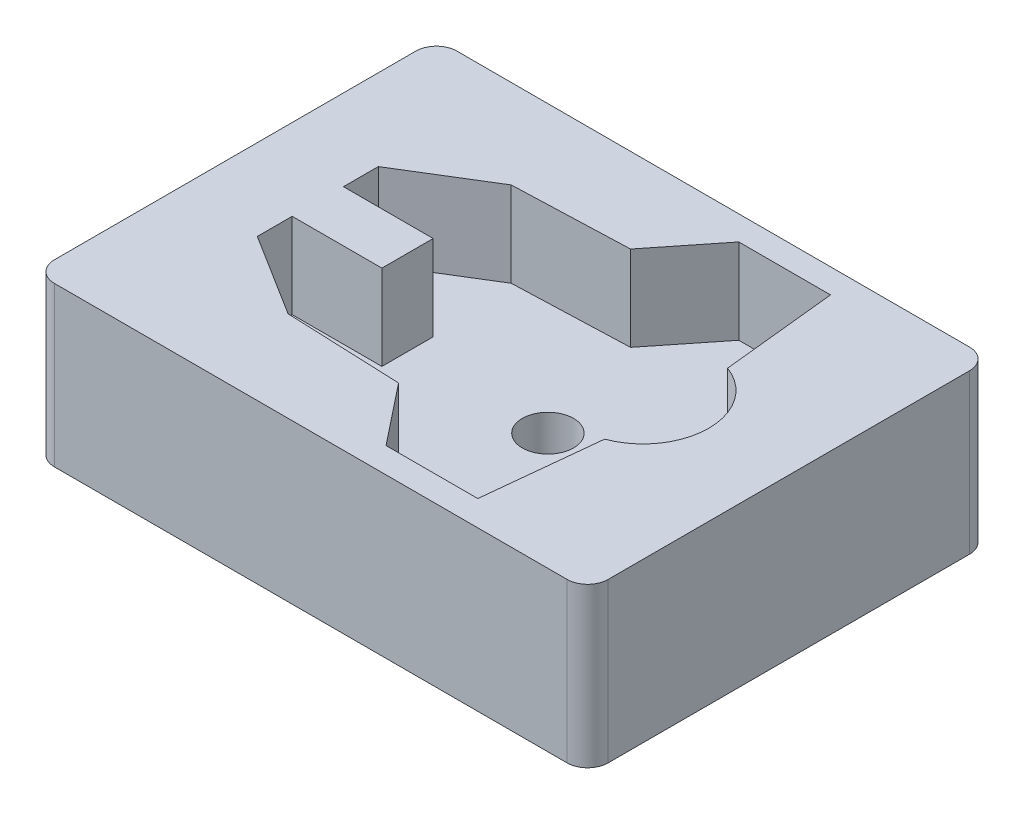
from build123d import *

# Parameters (mm, degrees)
SKETCH1_W              = 54
SKETCH1_H              = 39.25
BOSS_EXTRUDE1_DEPTH    = 15.5
FILLET1_R              = 2
FILLET2_R              = 2
M3_A_START             = -3.329776532
M3_A_BLANK_DEPTH       = 9
M3_A_START_2           = -9.329776532
M3_A_BLANK_2_OUTLINE_R = 2.5
M3_A_BLANK_2_DEPTH     = 6
BODY_MOVE_COPY6_ANGLE  = 90
CUT_EXTRUDE1_DEPTH     = 13.5


with BuildPart() as part:
    # Sketch1 → Boss-Extrude1 (new body)
    with BuildSketch(Plane(origin=(0, 0, 0), x_dir=(1, 0, 0), z_dir=(0, 1, 0))):
        with Locations((27, 19.625)):
            Rectangle(SKETCH1_W, SKETCH1_H)
    extrude(amount=BOSS_EXTRUDE1_DEPTH)

    # Fillet1
    fillet1_edges = [part.edges().sort_by_distance(p)[0] for p in [
        (0, 7.75, 0),
    ]]
    fillet(fillet1_edges, radius=FILLET1_R)

    # Fillet2
    fillet2_edges = [part.edges().sort_by_distance(p)[0] for p in [
        (0, 7.75, -39.25),
        (54, 7.75, -39.25),
        (54, 7.75, 0),
    ]]
    fillet(fillet2_edges, radius=FILLET2_R)


with BuildPart() as body_2:
    # M3-A Blank: read off the stored shape, not the designer's step
    # M3-A Blank outline → M3-A Blank (new body)
    with BuildSketch(Plane(origin=(0, 0, 0), x_dir=(1, 0, 0), z_dir=(0, 1, 0)).offset(M3_A_START)):
        with BuildLine():
            Line((-41.581939277, 43.861919588), (-30.381939277, 42.692718591))
            ThreePointArc((-30.381939277, 42.692718591), (-24.381939277, 38.532817401), (-18.381939277, 42.692718591))
            Line((-18.381939277, 42.692718591), (-7.181939277, 43.861919588))
            Line((-7.181939277, 43.861919588), (-7.181939277, 52.808848959))
            Line((-7.181939277, 52.808848959), (-13.057281533, 57.485652948))
            Line((-13.057281533, 57.485652948), (-13.463960141, 68.720149487))
            Line((-13.463960141, 68.720149487), (-18.39493826, 76.75205199))
            Line((-18.39493826, 76.75205199), (-21.79493826, 76.75205199))
            Line((-21.79493826, 76.75205199), (-21.79493826, 68.00205199))
            Line((-21.79493826, 68.00205199), (-26.79493826, 68.00205199))
            Line((-26.79493826, 68.00205199), (-26.79493826, 76.75205199))
            Line((-26.79493826, 76.75205199), (-30.19493826, 76.75205199))
            Line((-30.19493826, 76.75205199), (-35.227586031, 68.720149487))
            Line((-35.227586031, 68.720149487), (-35.685099465, 57.485652948))
            Line((-35.685099465, 57.485652948), (-41.581939277, 52.808848959))
            Line((-41.581939277, 52.808848959), (-41.581939277, 43.861919588))
        make_face()
    extrude(amount=M3_A_BLANK_DEPTH)

    # M3-A Blank 2 outline → M3-A Blank 2 (add)
    with BuildSketch(Plane(origin=(0, 0, 0), x_dir=(1, 0, 0), z_dir=(0, 1, 0)).offset(M3_A_START_2)):
        with Locations((-24.335480832, 54.269355582)):
            Circle(M3_A_BLANK_2_OUTLINE_R)
    extrude(amount=M3_A_BLANK_2_DEPTH)


with BuildPart() as body_2_1:
    # Body-Move/Copy4: moved
    add(body_2.part.moved(Location((42.5, 8.919688157, 37.96700657))))


with BuildPart() as body_2_2:
    # Body-Move/Copy5: moved
    add(body_2_1.part.moved(Location((8.915108254, 0, 0))))


with BuildPart() as body_2_3:
    # Body-Move/Copy6: moved
    add(body_2_2.part.rotate(Axis((27.033168977, 0, -19.675428126), (0, 1, 0)), BODY_MOVE_COPY6_ANGLE))


with BuildPart() as body_2_4:
    # Body-Move/Copy7: moved
    add(body_2_3.part.moved(Location((0, 1.103676274, 0))))


with BuildPart() as body_2_5:
    # Body-Move/Copy8: moved
    add(body_2_4.part.moved(Location((0, 0.5, 0))))


with BuildPart() as part_1:
    add(part.part)

    # Intersect1: read off the stored shape, not the designer's step
    # Intersect1: cut body 2
    add(body_2_5.part, mode=Mode.SUBTRACT)

    # Sketch3 → Cut-Extrude1 (cut)
    with BuildSketch(Plane(origin=(0, 0, 0), x_dir=(-1, 0, 0), z_dir=(0, -1, 0))):
        Polygon((-5.923551682, 12.755419679), (-16.048628272, 6.41122612), (-26.192603819, 6.41122612), (-29.691162465, 2), (-2, 2), (-2, 14.017695962), (-5.923551682, 14.017695962), align=None)
        Polygon((-2, 37.25), (-29.60864948, 37.25), (-26.198159594, 32.965493874), (-15.357384062, 32.57306761), (-5.923551682, 26.781411023), (-5.923551682, 25.507817982), (-2, 25.507817982), align=None)
        Polygon((-5.923551682, 20.262429143), (-14.673551682, 20.262429143), (-14.673551682, 19.262429143), (-5.923551682, 19.262429143), (-5.923551682, 16.008924411), (-2, 16.008924411), (-2, 23.521920083), (-5.923551682, 23.521920083), align=None)
        with BuildLine():
            Line((-42.774921098, 2), (-52, 2))
            Line((-52, 2), (-52, 18.627764364))
            Line((-52, 18.627764364), (-48.077251764, 18.627764364))
            ThreePointArc((-48.077251764, 18.627764364), (-46.712904885, 14.985289801), (-43.85505184, 12.346778986))
            Line((-43.85505184, 12.346778986), (-42.774921098, 2))
        make_face()
        with BuildLine():
            Line((-52, 37.25), (-42.78544978, 37.25))
            Line((-42.78544978, 37.25), (-43.85505184, 27.004077266))
            ThreePointArc((-43.85505184, 27.004077266), (-46.741831066, 24.322246322), (-48.089593706, 20.619646239))
            Line((-48.089593706, 20.619646239), (-52, 20.619646239))
            Line((-52, 20.619646239), (-52, 37.25))
        make_face()
    extrude(amount=-CUT_EXTRUDE1_DEPTH, mode=Mode.SUBTRACT)


solid = part_1.part
